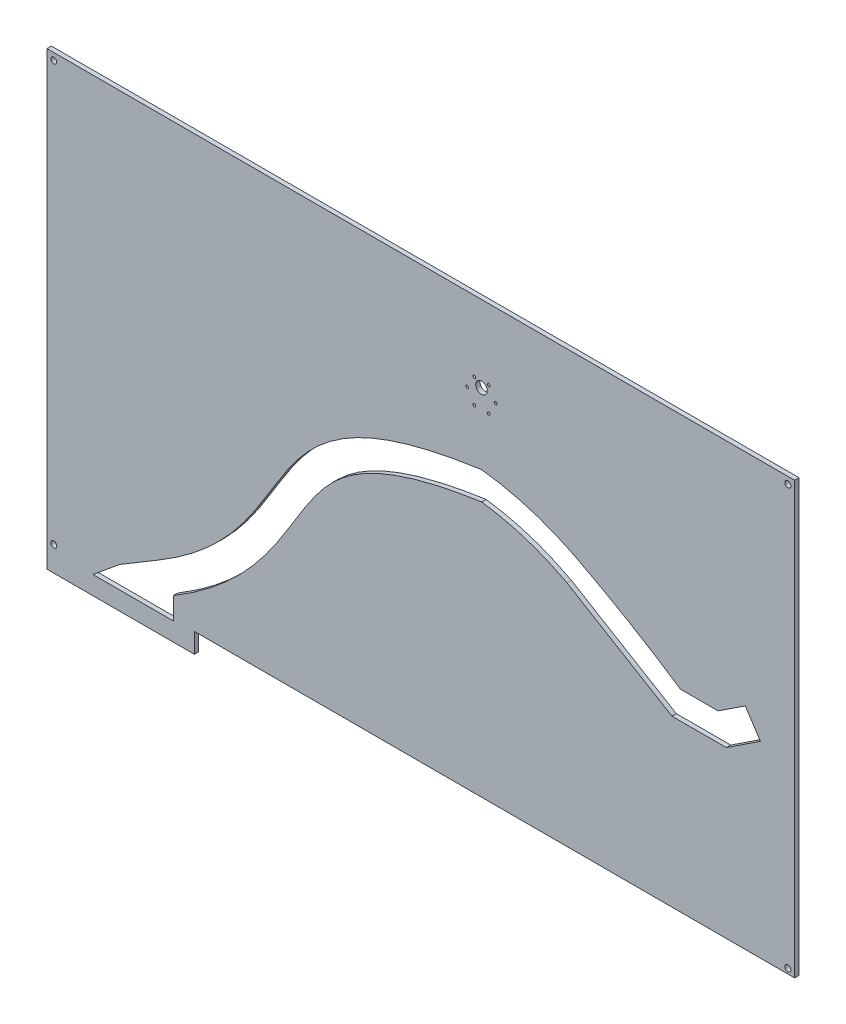
from build123d import *

# Parameters (mm, degrees)
SKETCH1_R           = 3.292374312
SKETCH1_R_2         = 3.294421934
SKETCH1_R_3         = 3.163533699
SKETCH1_R_4         = 1.5
SKETCH1_R_5         = 6.25
BOSS_EXTRUDE1_DEPTH = 4.7625


with BuildPart() as part:
    # Sketch1 → Boss-Extrude1 (new body)
    with BuildSketch(Plane.XY):
        Polygon((-436.816755826, -147.994392447), (215.080766979, -147.994392447), (215.080766979, 320), (-596.816755826, 320), (-596.816755826, -150), (-596.816755826, -169.55039994), (-436.816755826, -169.55039994), align=None)
        with Locations((-589.375723826, -142.5578)):
            Circle(SKETCH1_R, mode=Mode.SUBTRACT)
        with Locations((207.642212326, -142.5578)):
            Circle(SKETCH1_R, mode=Mode.SUBTRACT)
        with Locations((207.642212326, 312.5578)):
            Circle(SKETCH1_R_2, mode=Mode.SUBTRACT)
        with Locations((-589.375723826, 312.5578)):
            Circle(SKETCH1_R_3, mode=Mode.SUBTRACT)
        with Locations((-140.5, 230)):
            Circle(SKETCH1_R_4, mode=Mode.SUBTRACT)
        with Locations((-132.75, 243.423393759)):
            Circle(SKETCH1_R_4, mode=Mode.SUBTRACT)
        with Locations((-117.25, 243.423393759)):
            Circle(SKETCH1_R_4, mode=Mode.SUBTRACT)
        with Locations((-109.5, 230)):
            Circle(SKETCH1_R_4, mode=Mode.SUBTRACT)
        with Locations((-117.25, 216.576606241)):
            Circle(SKETCH1_R_4, mode=Mode.SUBTRACT)
        with Locations((-132.75, 216.576606241)):
            Circle(SKETCH1_R_4, mode=Mode.SUBTRACT)
        with Locations((-125, 237)):
            Circle(SKETCH1_R_5, mode=Mode.SUBTRACT)
        with BuildLine():
            Line((-475, -100), (-518.031074044, -125.74437106))
            Line((-518.031074044, -125.74437106), (-546.780363752, -149.55039994))
            Line((-546.780363752, -149.55039994), (-459.597813184, -149.55039994))
            Line((-459.597813184, -149.55039994), (-459.597813184, -125.74437106))
            add(Edge.make_bspline(
                [(-459.597813184, -125.74437106), (-458.129207209, -124.865742348), (-455.185829054, -123.081513508), (-449.471359557, -119.524654219), (-442.555549408, -115.046151368), (-434.636214281, -109.639746192), (-424.556425744, -102.386073958), (-412.829398694, -93.24529863), (-400.055778993, -82.1905419), (-388.486450966, -71.092190732), (-374.537420018, -56.304576734), (-359.620141336, -37.979207276), (-344.890774823, -16.767556206), (-332.340078528, 3.245699555), (-321.055163892, 21.796443272), (-310.225956981, 38.664819129), (-299.079604806, 53.834809894), (-286.812791685, 67.514642691), (-272.431751915, 80.088460877), (-257.652665703, 89.924055398), (-243.498210685, 97.442015492), (-231.565093385, 102.886615769), (-218.172694067, 108.112662921), (-203.190999217, 113.087836875), (-189.281720356, 116.996077726), (-177.243425929, 119.962936855), (-167.745823902, 122.104113686), (-157.766000623, 124.157339904), (-149.036898589, 125.791853127), (-141.799270328, 127.051772068), (-136.243143266, 127.972296195), (-131.502167372, 128.719120718), (-127.648712651, 129.303231945), (-125.690331117, 129.592450023), (-124.714693771, 129.734664734)],
                knots=[0, 0, 0, 0, 0.00777259, 0.01554518, 0.03109036, 0.04663554, 0.062180721, 0.093271081, 0.124361441, 0.155451801, 0.186542162, 0.248722882, 0.310903603, 0.373084323, 0.435265044, 0.497445764, 0.559626485, 0.621807206, 0.683987926, 0.746168647, 0.777259007, 0.808349367, 0.839439728, 0.870530088, 0.901620448, 0.917165628, 0.932710808, 0.948255989, 0.963801169, 0.971573759, 0.979346349, 0.987118939, 0.991005234, 0.994891529, 0.994891529, 0.994891529, 0.994891529], degree=3))
            ThreePointArc((-124.714693771, 129.734664734), (-77.172123272, 119.052933104), (-32.323699215, 100))
            Line((-32.323699215, 100), (81.77450832, 31.56416045))
            Line((81.77450832, 31.56416045), (140.88780849, 31.56416045))
            Line((140.88780849, 31.56416045), (177.923308763, 55.973921994))
            Line((177.923308763, 55.973921994), (161.413907899, 81.022668132))
            Line((161.413907899, 81.022668132), (131.890654865, 61.56416045))
            Line((131.890654865, 61.56416045), (90.97120992, 61.56416045))
            ThreePointArc((90.97120992, 61.56416045), (35.57180112, 96.520479224), (-21.701372103, 128.313911667))
            Line((-21.701372103, 128.313911667), (-25, 130))
            ThreePointArc((-25, 130), (-73.684930832, 149.383563894), (-125, 160))
            add(Edge.make_bspline(
                [(-475, -100), (-419.540575809, -66.820070684), (-329.590802121, 43.11603253), (-307.635554762, 134.287094016), (-125, 160)],
                knots=[0, 0, 0, 0, 0.312223899, 1, 1, 1, 1], degree=3))
        make_face(mode=Mode.SUBTRACT)
    extrude(amount=BOSS_EXTRUDE1_DEPTH)


solid = part.part
